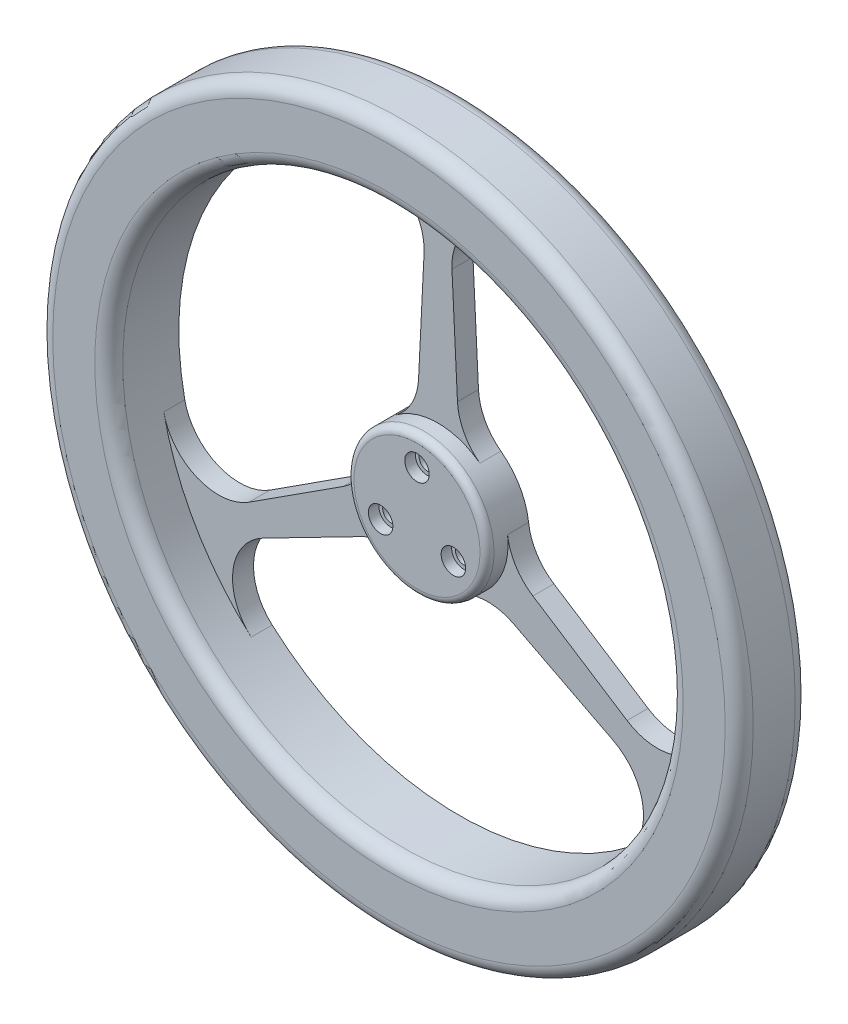
from build123d import *

# Parameters (mm, degrees)
SKETCH1_R                = 50
SKETCH1_R_2              = 40
EXTRUDE_THIN1_DEPTH      = 10
SKETCH2_R                = 10
BOSS_EXTRUDE1_DEPTH      = 6
BOSS_EXTRUDE4_DEPTH      = 3
M2_CLEARANCE_HOLE1_D     = 2.4
M2_CLEARANCE_HOLE1_DEPTH = 10
M2_CLEARANCE_HOLE1_TIP   = 0.721032743
FILLET4_R                = 8
FILLET2_R                = 1
FILLET3_R                = 2
SKETCH7_R                = 4.6
CUT_EXTRUDE1_DEPTH       = 4
SKETCH8_R                = 1.75
CUT_EXTRUDE2_DEPTH       = 1.5
CIRPATTERN1_COUNT        = 3


with BuildPart() as part:
    # Sketch1 → Extrude-Thin1 (new body)
    with BuildSketch(Plane.XY):
        Circle(SKETCH1_R)
        Circle(SKETCH1_R_2, mode=Mode.SUBTRACT)
    extrude(amount=EXTRUDE_THIN1_DEPTH)



with BuildPart() as body_2:
    # Sketch2 → Boss-Extrude1 (new body)
    with BuildSketch(Plane.XY):
        Circle(SKETCH2_R)
    extrude(amount=BOSS_EXTRUDE1_DEPTH)


with BuildPart() as part_1:
    add(part.part)

    add(body_2.part)  # Boss-Extrude4 merges body 2
    # Sketch3 → Boss-Extrude4 (add)
    with BuildSketch(Plane.XY):
        with BuildLine():
            ThreePointArc((-3, 9.539392014), (-1.517576993, 9.884177258), (0, 10))
            Line((0, 10), (0, 40))
            ThreePointArc((0, 40), (-0.75, 39.992968132), (-1.499736305, 39.971875))
            Line((-1.499736305, 39.971875), (-3, 9.539392014))
        make_face()
        with BuildLine():
            Line((0, 40), (0, 10))
            ThreePointArc((0, 10), (1.517576993, 9.884177258), (3, 9.539392014))
            Line((3, 9.539392014), (1.499736305, 39.971875))
            ThreePointArc((1.499736305, 39.971875), (0.75, 39.992968132), (0, 40))
        make_face()
        with BuildLine():
            Line((6.761355821, -7.367772218), (33.866791034, -21.284747239))
            ThreePointArc((33.866791034, -21.284747239), (34.641016151, -20), (35.366527339, -18.687127761))
            Line((35.366527339, -18.687127761), (9.761355821, -2.171619796))
            ThreePointArc((9.761355821, -2.171619796), (8.660254038, -5), (6.761355821, -7.367772218))
        make_face()
        with BuildLine():
            ThreePointArc((-35.366527339, -18.687127761), (-34.641016151, -20), (-33.866791034, -21.284747239))
            Line((-33.866791034, -21.284747239), (-6.761355821, -7.367772218))
            ThreePointArc((-6.761355821, -7.367772218), (-8.660254038, -5), (-9.761355821, -2.171619796))
            Line((-9.761355821, -2.171619796), (-35.366527339, -18.687127761))
        make_face()
    extrude(amount=BOSS_EXTRUDE4_DEPTH)

    # M2 Clearance Hole1
    with Locations(Plane.XY.offset(6)):
        with Locations((0, 6), (-5.196152423, -3), (5.196152423, -3)):
            Hole(M2_CLEARANCE_HOLE1_D / 2, depth=M2_CLEARANCE_HOLE1_DEPTH)
            with Locations((0, 0, -(M2_CLEARANCE_HOLE1_DEPTH + M2_CLEARANCE_HOLE1_TIP / 2))):  # 118° drill point
                Cone(0, M2_CLEARANCE_HOLE1_D / 2, M2_CLEARANCE_HOLE1_TIP, mode=Mode.SUBTRACT)

    # Fillet4
    # the kernel refuses this fillet: 8 mm, written as the material it adds along each edge
    with BuildSketch(Plane(origin=(-3, 9.539392014, 0), x_dir=(-0.8901966603101863, -0.45557645458538654, 0), z_dir=(0, 0, 1)), Plane(origin=(9.761355821, -2.171619796, 0), x_dir=(0.05055754711810484, 0.9987211494853809, 0), z_dir=(0, 0, 1)), Plane(origin=(-6.761355821, -7.367772218, 0), x_dir=(0.8396391131920856, -0.5431446948999943, 0), z_dir=(0, 0, 1))) as fillet4_piece_1:
        with BuildLine():
            CenterArc((4.690930753, -7.886931421), FILLET4_R, 99.644427342, 50.431253784)
            Line((-2.242549971, -3.896086266), (0, 0))
            ThreePointArc((0, 0), (1.675332412, -0.141335724), (3.350664824, 0))
        make_face()
    extrude(amount=3)
    with BuildSketch(Plane(origin=(3, 9.539392014, 0), x_dir=(0.8901966603101863, -0.45557645458538637, 0), z_dir=(0, 0, 1)), Plane(origin=(6.761355821, -7.367772218, 0), x_dir=(-0.8396391131920875, -0.5431446948999916, 0), z_dir=(0, 0, 1)), Plane(origin=(-9.761355821, -2.171619796, 0), x_dir=(-0.05055754711810146, 0.9987211494853812, 0), z_dir=(0, 0, 1))) as fillet4_piece_2:
        with BuildLine():
            CenterArc((4.690930753, 7.886931421), FILLET4_R, 209.924318874, 50.431253784)
            Line((-2.242549971, 3.896086266), (0, 0))
            ThreePointArc((0, 0), (1.675332412, 0.141335724), (3.350664824, 0))
        make_face()
    extrude(amount=3)
    with BuildSketch(Plane(origin=(1.499736305, 39.971875, 0), x_dir=(0.04923830777365754, -0.9987870589107503, 0), z_dir=(0, 0, 1)), Plane(origin=(33.866791034, -21.284747239, 0), x_dir=(-0.8895941198746714, 0.4567519040840537, 0), z_dir=(0, 0, 1)), Plane(origin=(-35.366527339, -18.687127761, 0), x_dir=(0.8403558121010258, 0.542035154826719, 0), z_dir=(0, 0, 1))) as fillet4_piece_3:
        with BuildLine():
            CenterArc((9.974317113, 8), FILLET4_R, 159.003278938, 110.996721062)
            ThreePointArc((2.505509643, 10.866516174), (0.872211792, 5.521000489), (0, 0))
            Line((0, 0), (9.974317113, 0))
        make_face()
    extrude(amount=3)
    with BuildSketch(Plane(origin=(-1.499736305, 39.971875, 0), x_dir=(-0.04923830777365785, -0.9987870589107503, 0), z_dir=(0, 0, 1)), Plane(origin=(35.366527339, -18.687127761, 0), x_dir=(-0.8403558121010118, 0.5420351548267408, 0), z_dir=(0, 0, 1)), Plane(origin=(-33.866791034, -21.284747239, 0), x_dir=(0.8895941198746828, 0.4567519040840315, 0), z_dir=(0, 0, 1))) as fillet4_piece_4:
        with BuildLine():
            CenterArc((9.974317113, -8), FILLET4_R, 90, 110.996721062)
            ThreePointArc((2.505509643, -10.866516174), (0.872211792, -5.521000489), (0, 0))
            Line((0, 0), (9.974317113, 0))
        make_face()
    extrude(amount=3)

    # Fillet2
    fillet2_edges = [part_1.edges().sort_by_distance(p)[0] for p in [
        (-10, 0, 6),
    ]]
    fillet(fillet2_edges, radius=FILLET2_R)

    # Fillet3
    fillet3_edges = [part_1.edges().sort_by_distance(p)[0] for p in [
        (-50, 0, 0),
        (-50, 0, 10),
        (-40, 0, 10),
    ]]
    fillet(fillet3_edges, radius=FILLET3_R)

    # Sketch7 → Cut-Extrude1 (cut)
    with BuildSketch(Plane(origin=(0, 0, 0), x_dir=(-1, 0, 0), z_dir=(0, 0, -1))):
        Circle(SKETCH7_R)
    extrude(amount=-CUT_EXTRUDE1_DEPTH, mode=Mode.SUBTRACT)

    # Sketch8 → Cut-Extrude2 (cut)
    with BuildSketch(Plane.XY.offset(6)):
        with Locations((0, 6)):
            Circle(SKETCH8_R)
    cut_extrude2 = extrude(amount=-CUT_EXTRUDE2_DEPTH, mode=Mode.SUBTRACT)

    # CirPattern1: Cut-Extrude2 ×3 about axis
    cirpattern1_axis = Axis((0, 0, 0), (0, 0, 1))
    for i in range(1, CIRPATTERN1_COUNT):
        add(cut_extrude2.rotate(cirpattern1_axis, i * 360 / CIRPATTERN1_COUNT), mode=Mode.SUBTRACT)


solid = part_1.part
